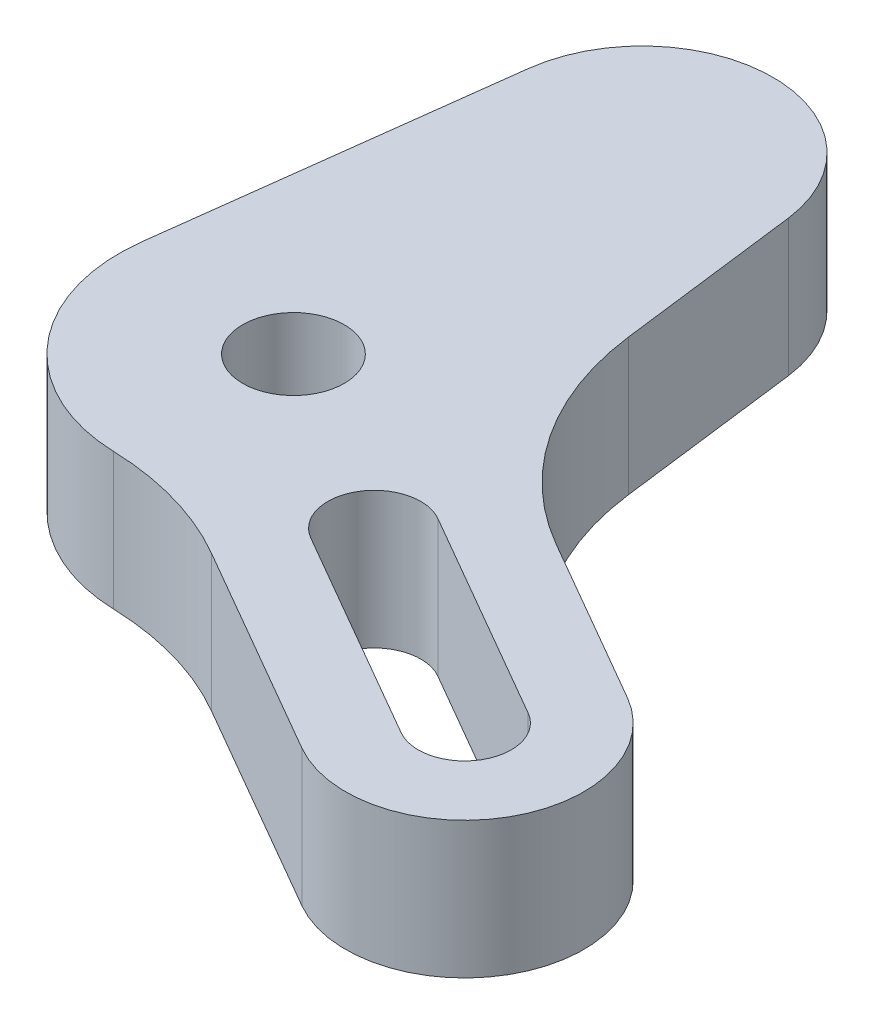
from build123d import *

# Parameters (mm, degrees)
EXTRUDE_THIN1_DEPTH = 1.7
BOSS_EXTRUDE1_DEPTH = 3
EXTRUDE_THIN2_DEPTH = 4.7
FILLET1_R           = 10
SKETCH5_R           = 1.75
CUT_EXTRUDE1_DEPTH  = 25.897593892909114


# Read off the part's stored shape, not the designer's step: Extrude-Thin1
with BuildPart() as part:
    # Extrude-Thin1 outline → Extrude-Thin1 (new body)
    with BuildSketch(Plane(origin=(0, 0, 0), x_dir=(1, 0, 0), z_dir=(0, 1, 0))):
        with BuildLine():
            ThreePointArc((4.464705337, 12.5625), (0, 16.5), (-4.464705337, 12.5625))
            Line((-4.464705337, 12.5625), (-5.95294045, 0.75))
            ThreePointArc((-5.95294045, 0.75), (0, -6), (5.95294045, 0.75))
            Line((5.95294045, 0.75), (4.464705337, 12.5625))
        make_face()
        with BuildLine():
            Line((-3.472548596, 0.4375), (-1.984313483, 12.25))
            ThreePointArc((-1.984313483, 12.25), (0, 14), (1.984313483, 12.25))
            Line((1.984313483, 12.25), (3.472548596, 0.4375))
            ThreePointArc((3.472548596, 0.4375), (0, -3.5), (-3.472548596, 0.4375))
        make_face(mode=Mode.SUBTRACT)
    extrude(amount=EXTRUDE_THIN1_DEPTH)

    # Sketch2 → Boss-Extrude1 (add)
    with BuildSketch(Plane(origin=(0, 1.7, 0), x_dir=(1, 0, 0), z_dir=(0, 1, 0))):
        with BuildLine():
            Line((4.464705337421497, 12.5625), (5.952940449895328, 0.7499999999999997))
            ThreePointArc((5.952940449895328, 0.7499999999999997), (-1.1e-15, -6.000000000000001), (-5.95294044989533, 0.7500000000000003))
            Line((-5.95294044989533, 0.7500000000000003), (-4.464705337421497, 12.562499999999998))
            ThreePointArc((-4.464705337421497, 12.562499999999998), (-7.2e-16, 16.5), (4.464705337421497, 12.5625))
        make_face()
    extrude(amount=BOSS_EXTRUDE1_DEPTH)

    # Sketch4 → Extrude-Thin2 (add, through all)
    with BuildSketch(Plane(origin=(0, 4.7, 0), x_dir=(1, 0, 0), z_dir=(0, 1, 0))):
        with BuildLine():
            Line((8.631793068761734, -0.2492958444837754), (15.993009000929478, -4.499295844483755))
            ThreePointArc((15.99300900092945, -4.499295844483736), (17.49371315644571, -10.099999999999966), (11.893009000929466, -11.600704155516153))
            Line((11.893009000929494, -11.60070415551617), (4.531793068761752, -7.350704155516189))
            ThreePointArc((4.531793068761758, -7.350704155516187), (3.0310889132455334, -1.7499999999999925), (8.631793068761736, -0.24929584448377584))
        make_face()
        with BuildLine():
            Line((7.381793068761741, -2.4143593539448753), (14.743009000929485, -6.664359353944855))
            ThreePointArc((14.743009000929485, -6.664359353944855), (15.328649646984612, -8.849999999999971), (13.143009000929489, -9.43564064605507))
            Line((13.143009000929489, -9.43564064605507), (5.781793068761747, -5.185640646055089))
            ThreePointArc((5.781793068761747, -5.185640646055089), (5.196152422706634, -2.999999999999985), (7.381793068761741, -2.4143593539448753))
        make_face(mode=Mode.SUBTRACT)
    extrude(amount=-EXTRUDE_THIN2_DEPTH)

    # Fillet1
    fillet1_edges = [part.edges().sort_by_distance(p)[0] for p in [
        (5.994462735157251, 3.2, -0.2577140213706832),
        (2.7740444781602016, 3.2, 5.320214021370655),
    ]]
    fillet(fillet1_edges, radius=FILLET1_R)

    # Sketch5 → Cut-Extrude1 (cut, through all)
    with BuildSketch(Plane(origin=(0, 4.7, 0), x_dir=(1, 0, 0), z_dir=(0, 1, 0))):
        with Locations(Location((0, 0, 0), (0, 0, 270))):
            Circle(SKETCH5_R)
    extrude(amount=-CUT_EXTRUDE1_DEPTH, mode=Mode.SUBTRACT)


solid = part.part
